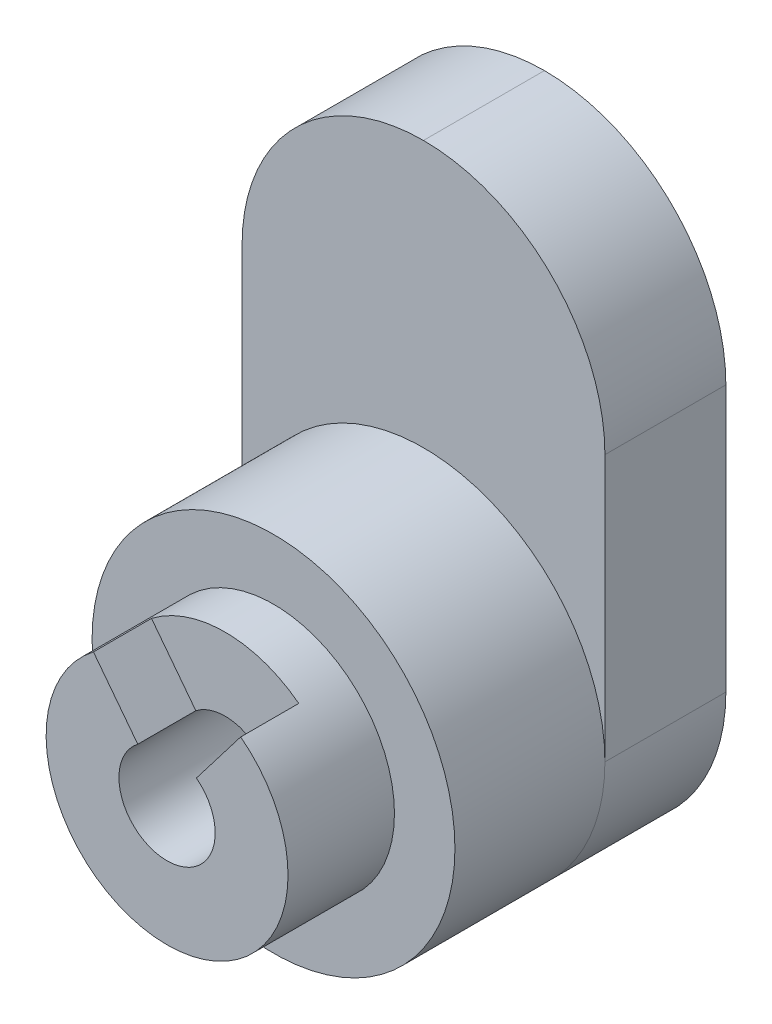
from build123d import *

# Parameters (mm, degrees)
SKETCH1_W                  = 19.05
SKETCH1_H                  = 33.02
BOSS_EXTRUDE1_DEPTH        = 6.35
SKETCH2_R                  = 6.35
BOSS_EXTRUDE2_DEPTH        = 13.462
F_8_0_199_DIAMETER_HOLE1_D = 5.0546
CUT_EXTRUDE1_DEPTH         = 2.54
SKETCH7_R                  = 9.525
SKETCH7_R_2                = 6.35
BOSS_EXTRUDE3_DEPTH        = 7.874
CUT_EXTRUDE2_START         = -3.048
CUT_EXTRUDE2_DEPTH         = 3.048
FILLET1_R                  = 9.525


with BuildPart() as part:
    # Sketch1 → Boss-Extrude1 (new body)
    with BuildSketch(Plane.XY):
        with Locations((0, 16.51)):
            Rectangle(SKETCH1_W, SKETCH1_H)
    extrude(amount=BOSS_EXTRUDE1_DEPTH)

    # Sketch2 → Boss-Extrude2 (add)
    with BuildSketch(Plane.XY.offset(6.35)):
        with Locations(Location((0, 9.525, 0), (0, 0, 180))):
            Circle(SKETCH2_R)
    extrude(amount=BOSS_EXTRUDE2_DEPTH)

    # #8 (0.199) Diameter Hole1 (through all)
    with Locations(Plane.XY.offset(19.812)):
        with Locations((0, 9.525)):
            Hole(F_8_0_199_DIAMETER_HOLE1_D / 2)

    # Sketch5 → Cut-Extrude1 (cut)
    with BuildSketch(Plane(origin=(0, 0, 0), x_dir=(-1, 0, 0), z_dir=(0, 0, -1))):
        Polygon((2.346351494, 5.461), (4.692702988, 9.525), (2.346351494, 13.589), (-2.346351494, 13.589), (-4.692702988, 9.525), (-2.346351494, 5.461), align=None)
    extrude(amount=-CUT_EXTRUDE1_DEPTH, mode=Mode.SUBTRACT)

    # Sketch7 → Boss-Extrude3 (add)
    with BuildSketch(Plane.XY.offset(6.35)):
        with Locations((0, 9.525)):
            Circle(SKETCH7_R)
        with Locations((0, 9.525)):
            Circle(SKETCH7_R_2, mode=Mode.SUBTRACT)
    extrude(amount=BOSS_EXTRUDE3_DEPTH)

    # Sketch8 → Cut-Extrude2 (cut)
    with BuildSketch(Plane.XY.offset(19.812).offset(CUT_EXTRUDE2_START)):
        with BuildLine():
            Line((1.53852276, 11.530041897), (3.865635074, 14.562793711))
            ThreePointArc((3.865635074, 14.562793711), (0, 15.875), (-3.865635074, 14.562793711))
            Line((-3.865635074, 14.562793711), (-1.53852276, 11.530041897))
            ThreePointArc((-1.53852276, 11.530041897), (0, 12.0523), (1.53852276, 11.530041897))
        make_face()
    extrude(amount=CUT_EXTRUDE2_DEPTH, mode=Mode.SUBTRACT)

    # Fillet1
    fillet1_edges = [part.edges().sort_by_distance(p)[0] for p in [
        (9.525, 0, 3.175),
        (-9.525, 0, 3.175),
        (9.525, 33.02, 3.175),
        (-9.525, 33.02, 3.175),
    ]]
    fillet(fillet1_edges, radius=FILLET1_R - 0.0001)  # a hair under: the kernel refuses the full size


solid = part.part
